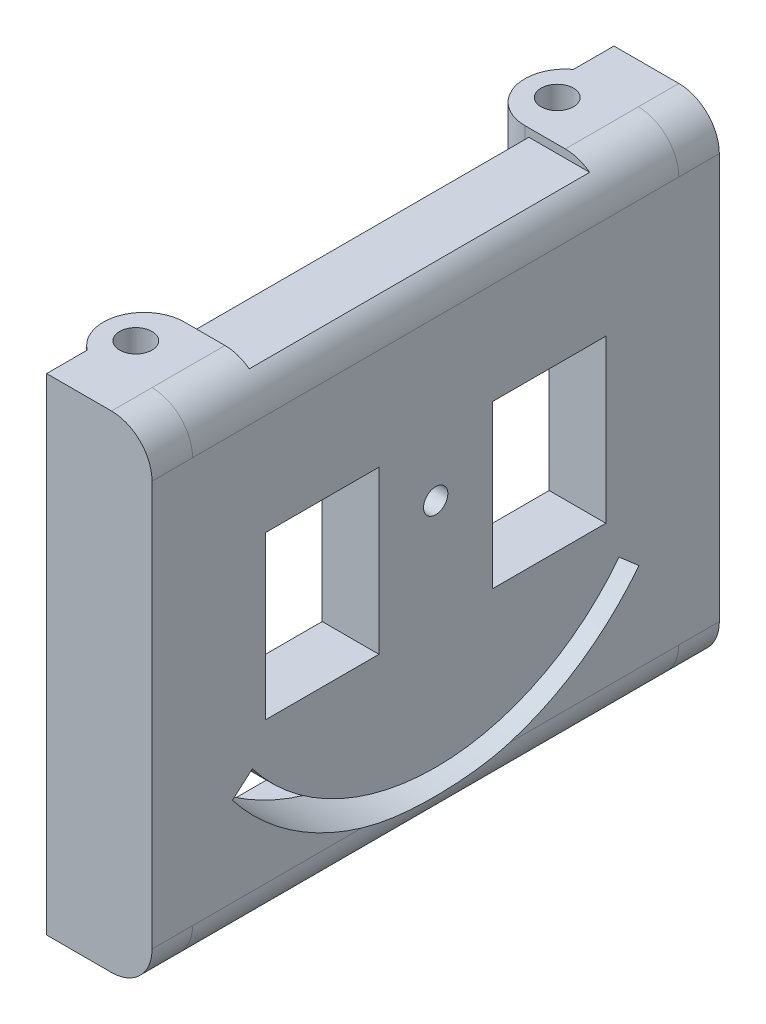
from build123d import *

# Parameters (mm, degrees)
EXTRUDE_1_DEPTH      = 62
FILLET_1_R           = 5
SKETCH_2_W           = 42
SKETCH_2_H           = 1
CUT_EXTRUDE_1_DEPTH  = 62
SKETCH_3_R           = 2
CUT_EXTRUDE_2_DEPTH  = 62
SKETCH_4_W           = 42
SKETCH_4_H           = 2.021
CUT_EXTRUDE_3_DEPTH  = 8
CUT_EXTRUDE_4_DEPTH  = 62
SKETCH_6_W           = 4
SKETCH_6_H           = 42
CUT_EXTRUDE_5_DEPTH  = 62
SKETCH_8_R           = 1.5
SKETCH_8_W           = 14
SKETCH_8_H           = 20
CUT_EXTRUDE_7_DEPTH  = 87.64871609
CUT_EXTRUDE_8_REACH  = 88.891
SKETCH_9_W           = 1.5
SKETCH_9_H           = 42
SKETCH_11_W          = 13.506471924
SKETCH_11_H          = 1
CUT_EXTRUDE_10_DEPTH = 88.572826992
SKETCH_13_W          = 13
SKETCH_13_H          = 60
EXTRUDE_5_DEPTH      = 5
FILLET_2_R           = 5
SKETCH_14_W          = 13
SKETCH_14_H          = 60
EXTRUDE_6_DEPTH      = 5
FILLET_3_R           = 5
SKETCH_15_W          = 0.4
SKETCH_15_H          = 50
CUT_EXTRUDE_11_DEPTH = 6


with BuildPart() as part:
    # 草图1 → 凸台-拉伸1 (new body)
    with BuildSketch(Plane.XY):
        Polygon((0, 5), (0, 0), (15, 0), (15, 60), (0, 60), (0, 55), (8, 55), (8, 5), align=None)
    extrude(amount=EXTRUDE_1_DEPTH)

    # 圆角1
    fillet_1_edges = [part.edges().sort_by_distance(p)[0] for p in [
        (15, 60, 31),
        (15, 0, 31),
    ]]
    fillet(fillet_1_edges, radius=FILLET_1_R)

    # 草图2 → 切除-拉伸1 (cut)
    with BuildSketch(Plane(origin=(15, 0, 0), x_dir=(0, 0, -1), z_dir=(1, 0, 0))):
        with Locations((-31, 59.5)):
            Rectangle(SKETCH_2_W, SKETCH_2_H)
    extrude(amount=-CUT_EXTRUDE_1_DEPTH, mode=Mode.SUBTRACT)

    # 草图3 → 切除-拉伸2 (cut)
    with BuildSketch(Plane(origin=(0, 60, 0), x_dir=(1, 0, 0), z_dir=(0, 1, 0))):
        with Locations(Location((4, -57, 0), (0, 0, 270))):
            Circle(SKETCH_3_R)
        with Locations(Location((4, -5, 0), (0, 0, 270))):
            Circle(SKETCH_3_R)
    extrude(amount=-CUT_EXTRUDE_2_DEPTH, mode=Mode.SUBTRACT)

    # 草图4 → 切除-拉伸3 (cut)
    with BuildSketch(Plane.ZY):
        with Locations((31, 56.0105)):
            Rectangle(SKETCH_4_W, SKETCH_4_H)
    extrude(amount=-CUT_EXTRUDE_3_DEPTH, mode=Mode.SUBTRACT)

    # 草图5 → 切除-拉伸4 (cut)
    with BuildSketch(Plane(origin=(0, 60, 0), x_dir=(1, 0, 0), z_dir=(0, 1, 0))):
        with BuildLine():
            ThreePointArc((0, -5), (1.464466094, -1.464466094), (5, 0))
            Line((5, 0), (0, 0))
            Line((0, 0), (0, -5))
        make_face()
        with BuildLine():
            ThreePointArc((5, -10), (1.464466094, -8.535533906), (0, -5))
            Line((0, -5), (0, -10))
            Line((0, -10), (5, -10))
        make_face()
        with BuildLine():
            ThreePointArc((0, -57), (1.464466094, -53.464466094), (5, -52))
            Line((5, -52), (0, -52))
            Line((0, -52), (0, -57))
        make_face()
        with BuildLine():
            ThreePointArc((5, -62), (1.464466094, -60.535533906), (0, -57))
            Line((0, -57), (0, -62))
            Line((0, -62), (5, -62))
        make_face()
    extrude(amount=-CUT_EXTRUDE_4_DEPTH, mode=Mode.SUBTRACT)

    # 草图6 → 切除-拉伸5 (cut)
    with BuildSketch(Plane(origin=(0, 59, 0), x_dir=(1, 0, 0), z_dir=(0, 1, 0))):
        with Locations((2, -31)):
            Rectangle(SKETCH_6_W, SKETCH_6_H)
    extrude(amount=-CUT_EXTRUDE_5_DEPTH, mode=Mode.SUBTRACT)

    # 草图8 → 切除-拉伸7 (cut, through all)
    with BuildSketch(Plane.ZY.offset(-8)):
        with Locations(Location((31, 35.417424305, 0), (0, 0, 270))):
            Circle(SKETCH_8_R)
        with Locations((17, 32.5)):
            Rectangle(SKETCH_8_W, SKETCH_8_H)
        with Locations((45, 32.5)):
            Rectangle(SKETCH_8_W, SKETCH_8_H)
        with BuildLine():
            Line((8.381832873, 18.077628579), (5.918671616, 15.942734126))
            ThreePointArc((5.918671616, 15.942734126), (31, 3.663108203), (56.081328384, 15.942734126))
            Line((56.081328384, 15.942734126), (53.618167127, 18.077628579))
            ThreePointArc((53.618167127, 18.077628579), (31, 6.917424305), (8.381832873, 18.077628579))
        make_face()
    extrude(amount=-CUT_EXTRUDE_7_DEPTH, mode=Mode.SUBTRACT)

    # 草图9 → 切除-拉伸8 (cut, up to next)
    with BuildSketch(Plane(origin=(0, 59, 0), x_dir=(1, 0, 0), z_dir=(0, 1, 0)), mode=Mode.PRIVATE) as cut_extrude_8_sk1:
        with Locations((4.75, -31)):
            Rectangle(SKETCH_9_W, SKETCH_9_H)
    cut_extrude_8_tool1 = extrude(cut_extrude_8_sk1.sketch, amount=-CUT_EXTRUDE_8_REACH, mode=Mode.PRIVATE) & part.part
    add(cut_extrude_8_tool1.solids().sort_by_distance((4.75, 59, 31))[0], mode=Mode.SUBTRACT)

    # 草图11 → 切除-拉伸10 (cut, through all)
    with BuildSketch(Plane(origin=(0, 60, 0), x_dir=(1, 0, 0), z_dir=(0, 1, 0))):
        with Locations((8.246764038, -61.5)):
            Rectangle(SKETCH_11_W, SKETCH_11_H)
        with Locations((8.246764038, -0.5)):
            Rectangle(SKETCH_11_W, SKETCH_11_H)
    extrude(amount=-CUT_EXTRUDE_10_DEPTH, mode=Mode.SUBTRACT)

    # 草图13 → 凸台-拉伸5 (add)
    with BuildSketch(Plane(origin=(0, 0, 1), x_dir=(-1, 0, 0), z_dir=(0, 0, -1))):
        with Locations((-8.5, 30)):
            Rectangle(SKETCH_13_W, SKETCH_13_H)
    extrude(amount=EXTRUDE_5_DEPTH)

    # 圆角2
    fillet_2_edges = [part.edges().sort_by_distance(p)[0] for p in [
        (15, 0, -1.5),
        (15, 60, -1.5),
    ]]
    fillet(fillet_2_edges, radius=FILLET_2_R)

    # 草图14 → 凸台-拉伸6 (add)
    with BuildSketch(Plane.XY.offset(61)):
        with Locations((8.5, 30)):
            Rectangle(SKETCH_14_W, SKETCH_14_H)
    extrude(amount=EXTRUDE_6_DEPTH)

    # 圆角3
    fillet_3_edges = [part.edges().sort_by_distance(p)[0] for p in [
        (15, 0, 63.5),
        (15, 60, 63.5),
    ]]
    fillet(fillet_3_edges, radius=FILLET_3_R - 0.0001)  # a hair under: the kernel refuses the full size

    # 草图15 → 切除-拉伸11 (cut)
    with BuildSketch(Plane.ZY.offset(-2)):
        with Locations((0.8, 30)):
            Rectangle(SKETCH_15_W, SKETCH_15_H)
    extrude(amount=-CUT_EXTRUDE_11_DEPTH, mode=Mode.SUBTRACT)


solid = part.part
